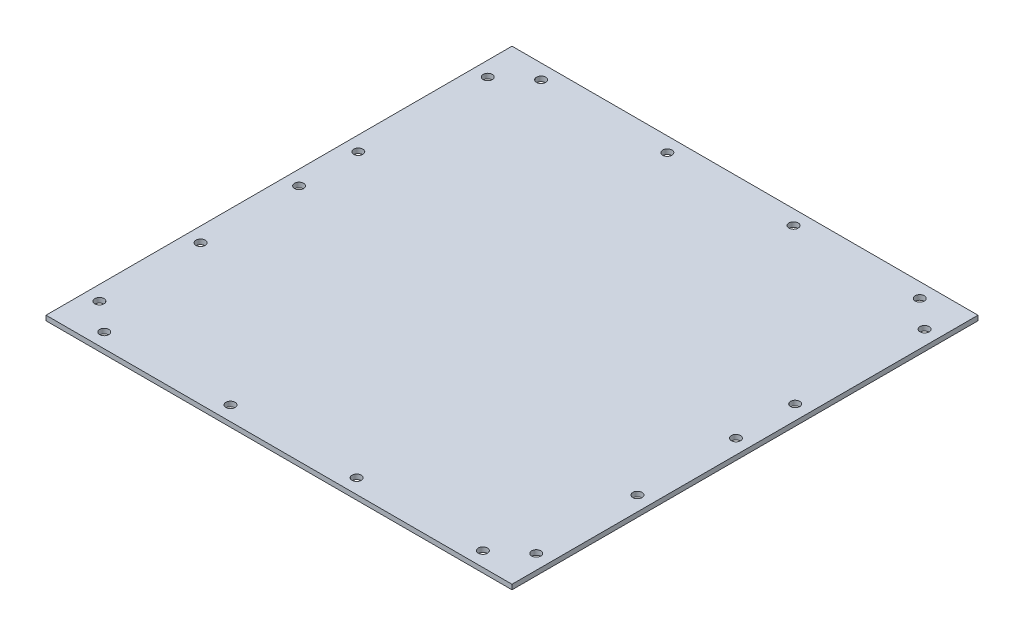
from build123d import *

# Parameters (mm, degrees)
SKETCH2_W             = 152.4
SKETCH2_H             = 152.4
BOSS_EXTRUDE1_DEPTH   = 1.5875
F_3_0MM_DOWEL_HOLE2_D = 3
F_3_0MM_DOWEL_HOLE3_D = 3
LPATTERN1_COUNT       = 4
LPATTERN1_PITCH       = 42.333333333
LPATTERN2_COUNT       = 4
LPATTERN2_PITCH       = 41.275
F_3_0MM_DOWEL_HOLE1_D = 3


with BuildPart() as part:
    # Sketch2 → Boss-Extrude1 (new body)
    with BuildSketch(Plane(origin=(0, 0, 0), x_dir=(1, 0, 0), z_dir=(0, 1, 0))):
        with Locations((76.2, 76.2)):
            Rectangle(SKETCH2_W, SKETCH2_H)
    extrude(amount=BOSS_EXTRUDE1_DEPTH)

    # Ø3.0mm Dowel Hole2 (through all)
    with Locations(Plane(origin=(0, 1.5875, 0), x_dir=(1, 0, 0), z_dir=(0, 1, 0))):
        with Locations((14.2875, 147.6375), (14.2875, 4.7625)):
            f_3_0mm_dowel_hole2 = Hole(F_3_0MM_DOWEL_HOLE2_D / 2)

    # Ø3.0mm Dowel Hole3 (through all)
    with Locations(Plane(origin=(0, 1.5875, 0), x_dir=(1, 0, 0), z_dir=(0, 1, 0))):
        with Locations((4.7625, 139.7), (147.6375, 139.7)):
            f_3_0mm_dowel_hole3 = Hole(F_3_0MM_DOWEL_HOLE3_D / 2)

    # LPattern1: Ø3.0mm Dowel Hole3 ×4, 1 skipped
    with Locations(*[(0, 0, i * LPATTERN1_PITCH) for i in range(1, LPATTERN1_COUNT) if i not in (2,)]):
        add(f_3_0mm_dowel_hole3, mode=Mode.SUBTRACT)

    # LPattern2: Ø3.0mm Dowel Hole2 ×4
    with Locations(*[(i * LPATTERN2_PITCH, 0, 0) for i in range(1, LPATTERN2_COUNT)]):
        add(f_3_0mm_dowel_hole2, mode=Mode.SUBTRACT)

    # Ø3.0mm Dowel Hole1 (through all)
    with Locations(Plane(origin=(0, 1.5875, 0), x_dir=(1, 0, 0), z_dir=(0, 1, 0))):
        with Locations((147.6375, 45.79), (147.6375, 78)):
            f_3_0mm_dowel_hole1 = Hole(F_3_0MM_DOWEL_HOLE1_D / 2)

    # Mirror1: Ø3.0mm Dowel Hole1 across plane
    add(f_3_0mm_dowel_hole1.mirror(Plane(origin=(76.2, 0, 0), x_dir=(0, 0, 1), z_dir=(1, 0, 0))), mode=Mode.SUBTRACT)


solid = part.part
